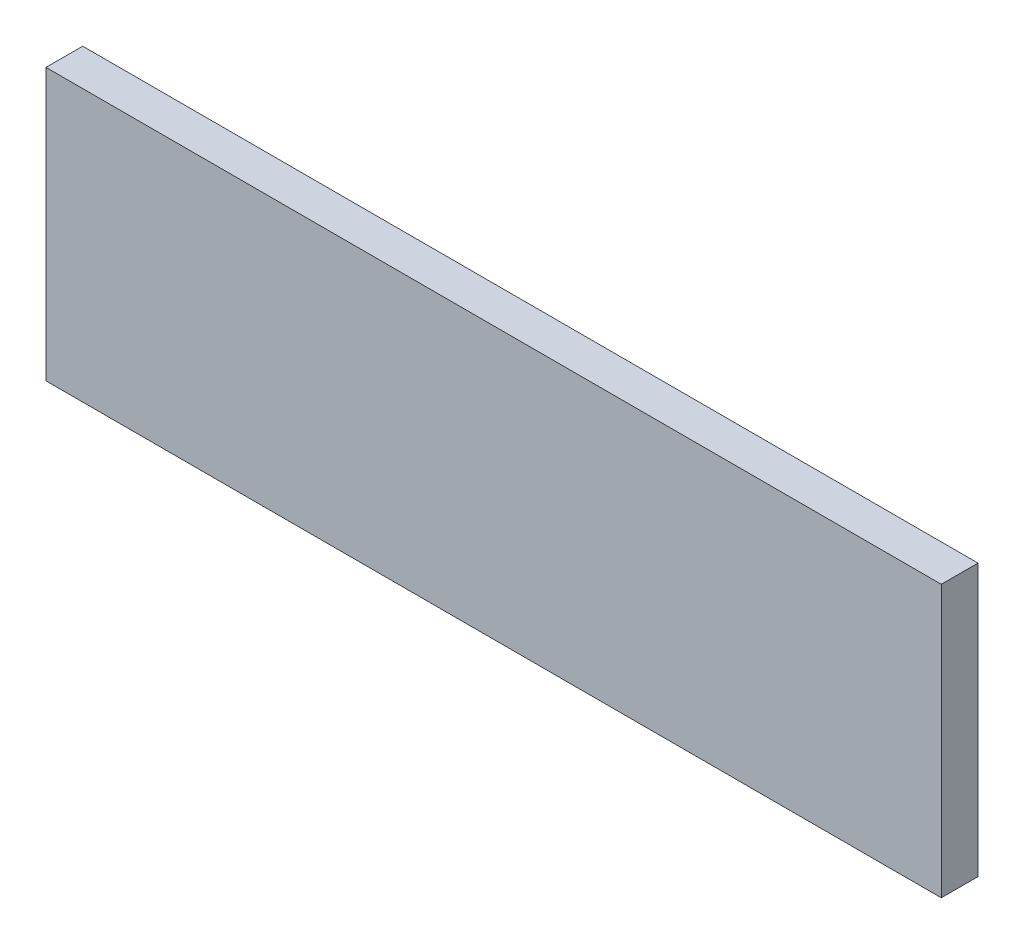
from build123d import *

# Parameters (mm, degrees)
SKETCH1_W           = 244
SKETCH1_H           = 74
BOSS_EXTRUDE1_DEPTH = 10


with BuildPart() as part:
    # Sketch1 → Boss-Extrude1 (new body)
    with BuildSketch(Plane.XY):
        with Locations((-205.300605602, 59.143326369)):
            Rectangle(SKETCH1_W, SKETCH1_H)
    extrude(amount=BOSS_EXTRUDE1_DEPTH)


solid = part.part
